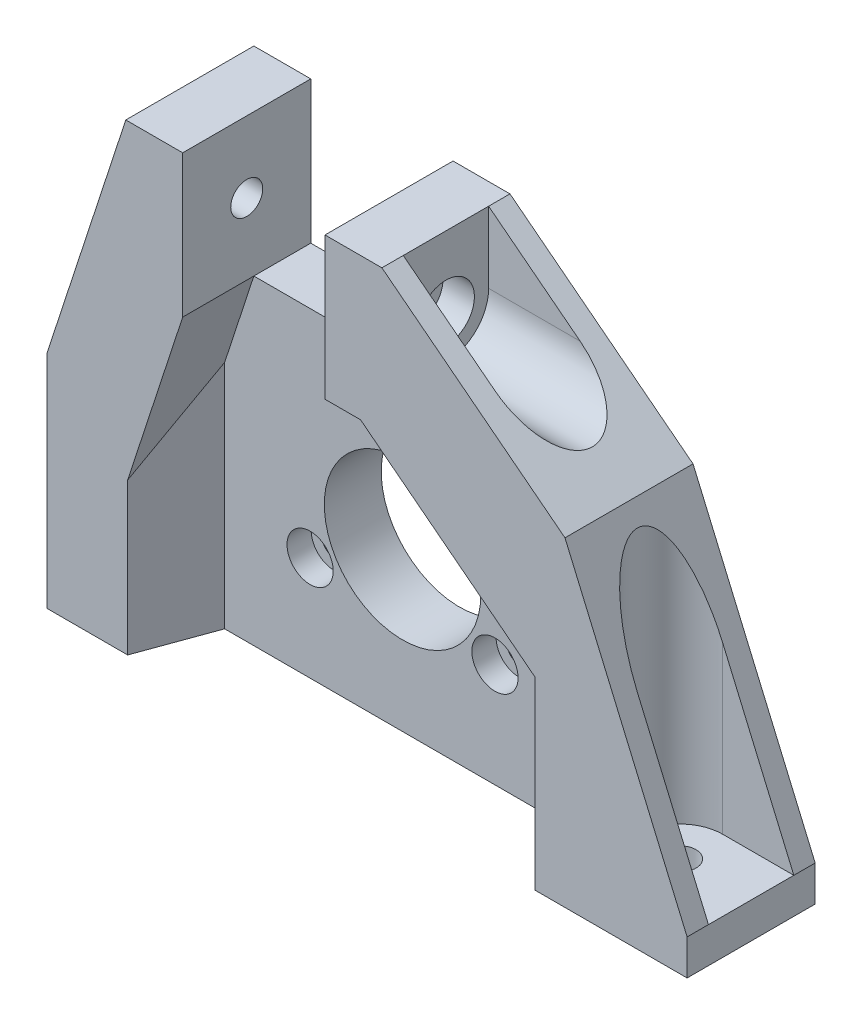
from build123d import *
from OCP.BRepFilletAPI import BRepFilletAPI_MakeChamfer

# Parameters (mm, degrees)
SKETCH1_R                                           = 11
BOSS_EXTRUDE1_DEPTH                                 = 18
CUT_EXTRUDE4_DEPTH                                  = 60
CUT_EXTRUDE5_DEPTH                                  = 10
CHAMFER1_SIZE                                       = 3.639702343
CHAMFER1_SIZE_2                                     = 10
CUT_EXTRUDE6_DEPTH                                  = 42.9
CUT_EXTRUDE7_START                                  = -11.1
CUT_EXTRUDE7_DEPTH                                  = 11.1
CBORE_FOR_M3_HEX_SOCKET_HEAD_CAP_SCREW2_D           = 3.4
CBORE_FOR_M3_HEX_SOCKET_HEAD_CAP_SCREW2_DEPTH       = 8
CBORE_FOR_M3_HEX_SOCKET_HEAD_CAP_SCREW2_CBORE_D     = 6.5
CBORE_FOR_M3_HEX_SOCKET_HEAD_CAP_SCREW2_CBORE_DEPTH = 3.4
CBORE_FOR_M3_HEX_SOCKET_HEAD_CAP_SCREW2_TIP         = 1.021463052
CBORE_FOR_M4_HEX_SOCKET_HEAD_CAP_SCREW1_D           = 4.5
CBORE_FOR_M4_HEX_SOCKET_HEAD_CAP_SCREW1_DEPTH       = 8
CBORE_FOR_M4_HEX_SOCKET_HEAD_CAP_SCREW1_CBORE_D     = 8
CBORE_FOR_M4_HEX_SOCKET_HEAD_CAP_SCREW1_CBORE_DEPTH = 4.4
CBORE_FOR_M4_HEX_SOCKET_HEAD_CAP_SCREW1_TIP         = 1.351936393
CBORE_FOR_M4_HEX_SOCKET_HEAD_CAP_SCREW2_D           = 4.5
CBORE_FOR_M4_HEX_SOCKET_HEAD_CAP_SCREW2_DEPTH       = 8
CBORE_FOR_M4_HEX_SOCKET_HEAD_CAP_SCREW2_CBORE_D     = 8
CBORE_FOR_M4_HEX_SOCKET_HEAD_CAP_SCREW2_CBORE_DEPTH = 4.4
CBORE_FOR_M4_HEX_SOCKET_HEAD_CAP_SCREW2_TIP         = 1.351936393
M4_CLEARANCE_HOLE1_D                                = 4.5
M4_CLEARANCE_HOLE1_DEPTH                            = 8
M4_CLEARANCE_HOLE1_TIP                              = 1.351936393
F_4_0MM_DOWEL_HOLE1_D                               = 4
F_4_0MM_DOWEL_HOLE1_DEPTH                           = 8
F_4_0MM_DOWEL_HOLE1_TIP                             = 1.201721238


with BuildPart() as part:
    # Sketch1 → Boss-Extrude1 (new body)
    with BuildSketch(Plane.XY):
        Polygon((39.1, 65), (39.1, 45), (19.1, 45), (19.1, 65), (11.1, 65), (0, 31), (0, 0), (90, 0), (90, 5), (72.831044759, 45), (47.1, 65), align=None)
        with Locations((40, 22.15)):
            Circle(SKETCH1_R, mode=Mode.SUBTRACT)
    extrude(amount=BOSS_EXTRUDE1_DEPTH)

    # Sketch5 → Cut-Extrude4 (cut)
    with BuildSketch(Plane(origin=(0, 65, 0), x_dir=(1, 0, 0), z_dir=(0, 1, 0))):
        with BuildLine():
            Line((90, -15), (80, -15))
            ThreePointArc((80, -15), (74, -9), (80, -3))
            Line((80, -3), (90, -3))
            ThreePointArc((90, -3), (96, -9), (90, -15))
        make_face()
    extrude(amount=-CUT_EXTRUDE4_DEPTH, mode=Mode.SUBTRACT)

    # Sketch6 → Cut-Extrude5 (cut)
    with BuildSketch(Plane.XY.offset(18)):
        Polygon((19.1, 45), (15, 32.441441441), (15, 0), (65, 0), (65, 28.75503195), (44.1, 45), align=None)
    extrude(amount=-CUT_EXTRUDE5_DEPTH, mode=Mode.SUBTRACT)

    # Chamfer1
    chamfer1_edges_1 = [part.edges().sort_by_distance(p)[0] for p in [
        (15, 16.220720721, 18),
    ]]
    chamfer1_side_1 = [part.faces().sort_by_distance(p)[0] for p in [
        (14.927205953, 16.220720721, 18),
    ]]
    chamfer1_edges_2 = [part.edges().sort_by_distance(p)[0] for p in [
        (65, 14.377515975, 18),
    ]]
    chamfer1_side_2 = [part.faces().sort_by_distance(p)[0] for p in [
        (65.072794047, 14.377515975, 18),
    ]]
    chamfer1 = BRepFilletAPI_MakeChamfer(part.part.solid().wrapped)
    for e in chamfer1_edges_1:
        chamfer1.Add(CHAMFER1_SIZE - 0.0001, CHAMFER1_SIZE_2 - 0.0001, e.wrapped, chamfer1_side_1[0].wrapped)
    for e in chamfer1_edges_2:
        chamfer1.Add(CHAMFER1_SIZE - 0.0001, CHAMFER1_SIZE_2 - 0.0001, e.wrapped, chamfer1_side_2[0].wrapped)
    add(Compound.cast(chamfer1.Shape()), mode=Mode.REPLACE)  # a hair under: the kernel refuses the full size

    # Sketch7 → Cut-Extrude6 (cut)
    with BuildSketch(Plane(origin=(90, 0, 0), x_dir=(0, 0, -1), z_dir=(1, 0, 0))):
        with BuildLine():
            Line((-3, 65), (-3, 55))
            ThreePointArc((-3, 55), (-9, 49), (-15, 55))
            Line((-15, 55), (-15, 65))
            ThreePointArc((-15, 65), (-9, 71), (-3, 65))
        make_face()
    extrude(amount=-CUT_EXTRUDE6_DEPTH, mode=Mode.SUBTRACT)

    # Sketch8 → Cut-Extrude7 (cut)
    with BuildSketch(Plane.ZY.offset(CUT_EXTRUDE7_START)):
        with BuildLine():
            Line((15, 65), (15, 55))
            ThreePointArc((15, 55), (9, 49), (3, 55))
            Line((3, 55), (3, 65))
            ThreePointArc((3, 65), (9, 71), (15, 65))
        make_face()
    extrude(amount=CUT_EXTRUDE7_DEPTH, mode=Mode.SUBTRACT)

    # CBORE for M3 Hex Socket Head Cap Screw2
    with Locations(Plane.XY.offset(8)):
        with Locations((40, 37.15), (52.990381057, 14.65), (27.009618943, 14.65)):
            CounterBoreHole(CBORE_FOR_M3_HEX_SOCKET_HEAD_CAP_SCREW2_D / 2, CBORE_FOR_M3_HEX_SOCKET_HEAD_CAP_SCREW2_CBORE_D / 2, CBORE_FOR_M3_HEX_SOCKET_HEAD_CAP_SCREW2_CBORE_DEPTH, depth=CBORE_FOR_M3_HEX_SOCKET_HEAD_CAP_SCREW2_DEPTH)
            with Locations((0, 0, -(CBORE_FOR_M3_HEX_SOCKET_HEAD_CAP_SCREW2_DEPTH + CBORE_FOR_M3_HEX_SOCKET_HEAD_CAP_SCREW2_TIP / 2))):  # 118° drill point
                Cone(0, CBORE_FOR_M3_HEX_SOCKET_HEAD_CAP_SCREW2_D / 2, CBORE_FOR_M3_HEX_SOCKET_HEAD_CAP_SCREW2_TIP, mode=Mode.SUBTRACT)

    # CBORE for M4 Hex Socket Head Cap Screw1
    with Locations(Plane(origin=(47.1, 0, 0), x_dir=(0, 0, -1), z_dir=(1, 0, 0))):
        with Locations((-9, 55)):
            CounterBoreHole(CBORE_FOR_M4_HEX_SOCKET_HEAD_CAP_SCREW1_D / 2, CBORE_FOR_M4_HEX_SOCKET_HEAD_CAP_SCREW1_CBORE_D / 2, CBORE_FOR_M4_HEX_SOCKET_HEAD_CAP_SCREW1_CBORE_DEPTH, depth=CBORE_FOR_M4_HEX_SOCKET_HEAD_CAP_SCREW1_DEPTH)
            with Locations((0, 0, -(CBORE_FOR_M4_HEX_SOCKET_HEAD_CAP_SCREW1_DEPTH + CBORE_FOR_M4_HEX_SOCKET_HEAD_CAP_SCREW1_TIP / 2))):  # 118° drill point
                Cone(0, CBORE_FOR_M4_HEX_SOCKET_HEAD_CAP_SCREW1_D / 2, CBORE_FOR_M4_HEX_SOCKET_HEAD_CAP_SCREW1_TIP, mode=Mode.SUBTRACT)

    # CBORE for M4 Hex Socket Head Cap Screw2
    with Locations(Plane.ZY.offset(-11.1)):
        with Locations((9, 55)):
            CounterBoreHole(CBORE_FOR_M4_HEX_SOCKET_HEAD_CAP_SCREW2_D / 2, CBORE_FOR_M4_HEX_SOCKET_HEAD_CAP_SCREW2_CBORE_D / 2, CBORE_FOR_M4_HEX_SOCKET_HEAD_CAP_SCREW2_CBORE_DEPTH, depth=CBORE_FOR_M4_HEX_SOCKET_HEAD_CAP_SCREW2_DEPTH)
            with Locations((0, 0, -(CBORE_FOR_M4_HEX_SOCKET_HEAD_CAP_SCREW2_DEPTH + CBORE_FOR_M4_HEX_SOCKET_HEAD_CAP_SCREW2_TIP / 2))):  # 118° drill point
                Cone(0, CBORE_FOR_M4_HEX_SOCKET_HEAD_CAP_SCREW2_D / 2, CBORE_FOR_M4_HEX_SOCKET_HEAD_CAP_SCREW2_TIP, mode=Mode.SUBTRACT)

    # M4 Clearance Hole1
    with Locations(Plane(origin=(0, 5, 0), x_dir=(1, 0, 0), z_dir=(0, 1, 0))):
        with Locations((80, -9)):
            Hole(M4_CLEARANCE_HOLE1_D / 2, depth=M4_CLEARANCE_HOLE1_DEPTH)
            with Locations((0, 0, -(M4_CLEARANCE_HOLE1_DEPTH + M4_CLEARANCE_HOLE1_TIP / 2))):  # 118° drill point
                Cone(0, M4_CLEARANCE_HOLE1_D / 2, M4_CLEARANCE_HOLE1_TIP, mode=Mode.SUBTRACT)

    # Ø4.0mm Dowel Hole1
    with Locations(Plane(origin=(0, 0, 0), x_dir=(-1, 0, 0), z_dir=(0, -1, 0))):
        with Locations((-7, -12), (-7, -6)):
            Hole(F_4_0MM_DOWEL_HOLE1_D / 2, depth=F_4_0MM_DOWEL_HOLE1_DEPTH)
            with Locations((0, 0, -(F_4_0MM_DOWEL_HOLE1_DEPTH + F_4_0MM_DOWEL_HOLE1_TIP / 2))):  # 118° drill point
                Cone(0, F_4_0MM_DOWEL_HOLE1_D / 2, F_4_0MM_DOWEL_HOLE1_TIP, mode=Mode.SUBTRACT)


solid = part.part
